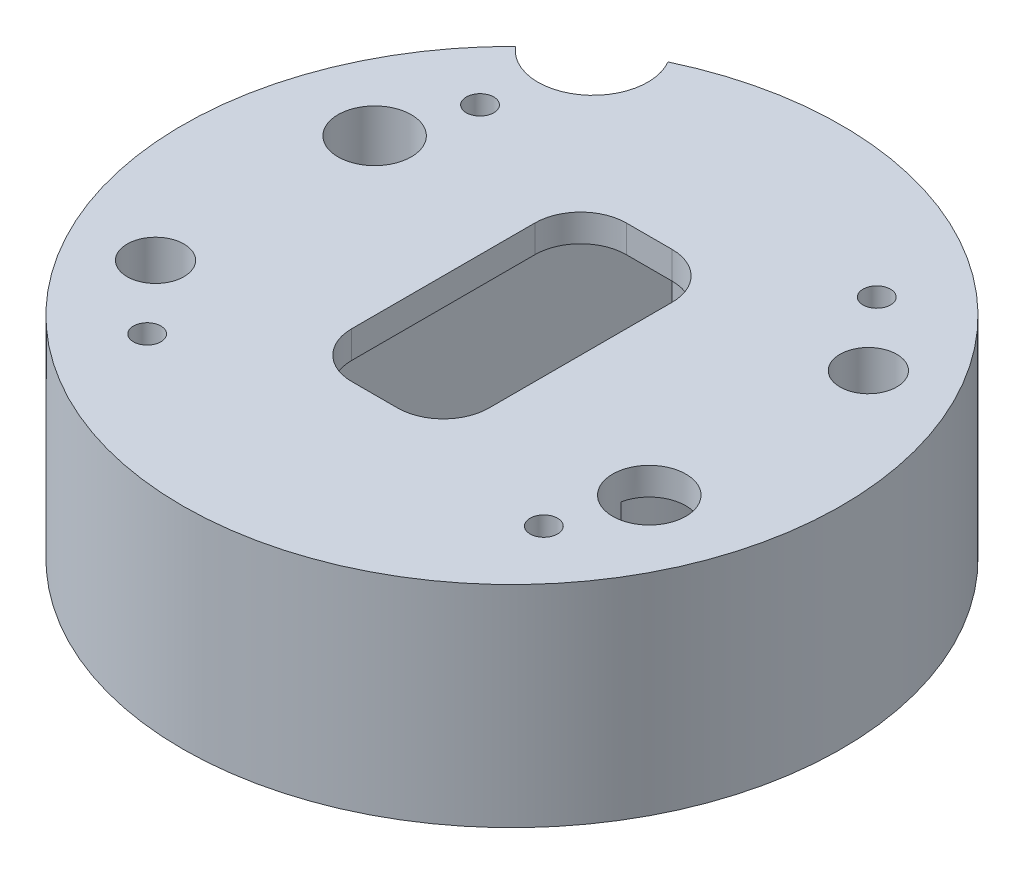
from build123d import *

# Parameters (mm, degrees)
SKETCH1_R               = 36
SKETCH1_R_2             = 9.5
SKETCH1_W               = 26
SKETCH1_H               = 61
BOSS_EXTRUDE1_DEPTH     = 20
SKETCH4_R               = 4
CUT_EXTRUDE6_DEPTH      = 55.699177325
SKETCH5_R               = 1.5
CUT_EXTRUDE2_DEPTH      = 20
CUT_EXTRUDE4_DEPTH      = 55.699177325
CUT_EXTRUDE4_DEPTH_BACK = 55.699177325
SKETCH6_R               = 3.1
CUT_EXTRUDE5_DEPTH      = 55.699177325
CUT_EXTRUDE5_DEPTH_BACK = 55.699177325
BOSS_EXTRUDE2_START     = 3
SKETCH9_W               = 15
SKETCH9_H               = 30
SKETCH9_R               = 1.5
SKETCH9_R_2             = 3.1
SKETCH9_R_3             = 4
BOSS_EXTRUDE2_DEPTH     = 3
FILLET1_R               = 5


with BuildPart() as part:
    # Sketch1 → Boss-Extrude1 (new body)
    with BuildSketch(Plane(origin=(0, 0, 0), x_dir=(1, 0, 0), z_dir=(0, 1, 0))):
        Circle(SKETCH1_R)
        with Locations((-24.5, 0)):
            Circle(SKETCH1_R_2, mode=Mode.SUBTRACT)
        with Locations((24.5, 0)):
            Circle(SKETCH1_R_2, mode=Mode.SUBTRACT)
        Rectangle(SKETCH1_W, SKETCH1_H, mode=Mode.SUBTRACT)
    extrude(amount=BOSS_EXTRUDE1_DEPTH)

    # Sketch4 → Cut-Extrude6 (cut, through all)
    with BuildSketch(Plane(origin=(0, 20, 0), x_dir=(1, 0, 0), z_dir=(0, 1, 0))):
        with Locations((-24.5, 9.5)):
            Circle(SKETCH4_R)
        with Locations((24.5, -9.5)):
            Circle(SKETCH4_R)
    extrude(amount=-CUT_EXTRUDE6_DEPTH, mode=Mode.SUBTRACT)

    # Sketch5 → Cut-Extrude2 (cut)
    with BuildSketch(Plane(origin=(0, 20, 0), x_dir=(1, 0, 0), z_dir=(0, 1, 0))):
        with Locations((-21.667008817, 18.180779107)):
            Circle(SKETCH5_R)
        with Locations((-18.180779107, -21.667008817)):
            Circle(SKETCH5_R)
        with Locations((21.667008817, -18.180779107)):
            Circle(SKETCH5_R)
        with Locations((18.180779107, 21.667008817)):
            Circle(SKETCH5_R)
    extrude(amount=-CUT_EXTRUDE2_DEPTH, mode=Mode.SUBTRACT)

    # Sketch6 → Cut-Extrude4 (cut, two sides: drawn at the far end of the back side and taken through both)
    with BuildSketch(Plane(origin=(0, 20, 0), x_dir=(1, 0, 0), z_dir=(0, 1, 0)).offset(-CUT_EXTRUDE4_DEPTH_BACK)):
        with Locations((-24.681724008, -14.25)):
            Circle(SKETCH6_R)
        with Locations((24.681724008, 14.25)):
            Circle(SKETCH6_R)
    extrude(amount=CUT_EXTRUDE4_DEPTH + CUT_EXTRUDE4_DEPTH_BACK, mode=Mode.SUBTRACT)

    # Sketch7 → Cut-Extrude5 (cut, two sides: drawn at the far end of the back side and taken through both)
    with BuildSketch(Plane(origin=(0, 20, 0), x_dir=(1, 0, 0), z_dir=(0, 1, 0)).offset(-CUT_EXTRUDE5_DEPTH_BACK)):
        with BuildLine():
            ThreePointArc((-25.259780357, 25.650409281), (-17.207293091, 24.574561329), (-15.464146624, 32.509385863))
            ThreePointArc((-15.464146624, 32.509385863), (-20.648751709, 29.489473594), (-25.259780357, 25.650409281))
        make_face()
    extrude(amount=CUT_EXTRUDE5_DEPTH + CUT_EXTRUDE5_DEPTH_BACK, mode=Mode.SUBTRACT)

    # Sketch9 → Boss-Extrude2 (add)
    with BuildSketch(Plane(origin=(0, 20, 0), x_dir=(1, 0, 0), z_dir=(0, 1, 0)).offset(BOSS_EXTRUDE2_START)):
        with BuildLine():
            ThreePointArc((-15.464146624, 32.509385863), (-17.207293091, 24.574561329), (-25.259780357, 25.650409281))
            ThreePointArc((-25.259780357, 25.650409281), (20.648751709, -29.489473594), (-15.464146624, 32.509385863))
        make_face()
        Rectangle(SKETCH9_W, SKETCH9_H, mode=Mode.SUBTRACT)
        with Locations((-18.180779107, -21.667008817)):
            Circle(SKETCH9_R, mode=Mode.SUBTRACT)
        with Locations((-24.681724008, -14.25)):
            Circle(SKETCH9_R_2, mode=Mode.SUBTRACT)
        with Locations((-24.5, 9.5)):
            Circle(SKETCH9_R_3, mode=Mode.SUBTRACT)
        with Locations((-21.667008817, 18.180779107)):
            Circle(SKETCH9_R, mode=Mode.SUBTRACT)
        with Locations((24.681724008, 14.25)):
            Circle(SKETCH9_R_2, mode=Mode.SUBTRACT)
        with Locations((18.180779107, 21.667008817)):
            Circle(SKETCH9_R, mode=Mode.SUBTRACT)
        with Locations((21.667008817, -18.180779107)):
            Circle(SKETCH9_R, mode=Mode.SUBTRACT)
        with Locations((24.5, -9.5)):
            Circle(SKETCH9_R_3, mode=Mode.SUBTRACT)
    extrude(amount=-BOSS_EXTRUDE2_DEPTH)

    # Fillet1
    fillet1_edges = [part.edges().sort_by_distance(p)[0] for p in [
        (7.5, 21.5, 15),
        (-7.5, 21.5, 15),
        (-7.5, 21.5, -15),
        (7.5, 21.5, -15),
    ]]
    fillet(fillet1_edges, radius=FILLET1_R)


solid = part.part
